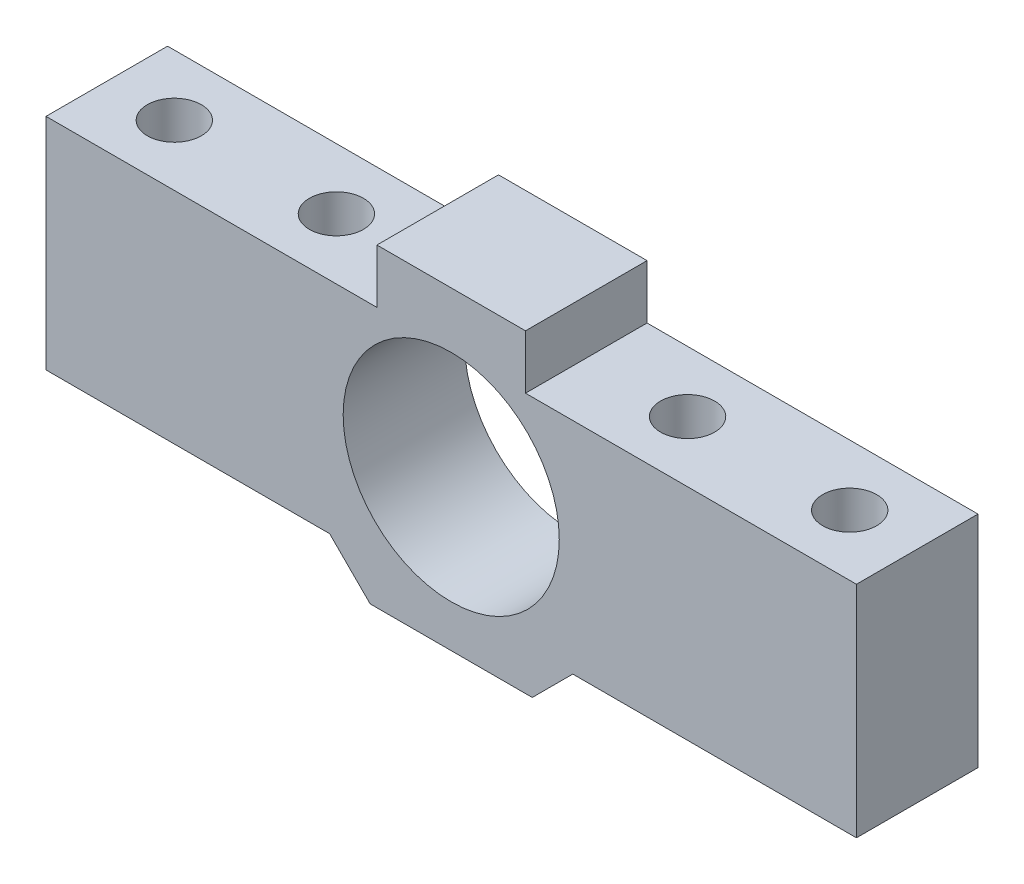
from build123d import *

# Parameters (mm, degrees)
ESQUISSE1_W             = 60
ESQUISSE1_H             = 16.26
ESQUISSE1_R             = 8
BOSS_EXTRU_1_DEPTH      = 9
ESQUISSE2_W             = 11
ESQUISSE2_H             = 4
BOSS_EXTRU_2_DEPTH      = 9
ESQUISSE3_W             = 12
ESQUISSE3_H             = 3
BOSS_EXTRU_3_DEPTH      = 9
CHANFREIN2_SIZE         = 3
ESQUISSE4_R             = 2
ENL_V_MAT_EXTRU_1_DEPTH = 64.964580824


with BuildPart() as part:
    # Esquisse1 → Boss.-Extru.1 (new body)
    with BuildSketch(Plane.XY):
        with Locations((30, 8.13)):
            Rectangle(ESQUISSE1_W, ESQUISSE1_H)
        with Locations((30, 8.13)):
            Circle(ESQUISSE1_R, mode=Mode.SUBTRACT)
    extrude(amount=BOSS_EXTRU_1_DEPTH)

    # Esquisse2 → Boss.-Extru.2 (add)
    with BuildSketch(Plane.XY.offset(9)):
        with Locations((30, 18.26)):
            Rectangle(ESQUISSE2_W, ESQUISSE2_H)
    extrude(amount=-BOSS_EXTRU_2_DEPTH)

    # Esquisse3 → Boss.-Extru.3 (add)
    with BuildSketch(Plane.XY.offset(9)):
        with Locations((30, -1.5)):
            Rectangle(ESQUISSE3_W, ESQUISSE3_H)
    extrude(amount=-BOSS_EXTRU_3_DEPTH)

    # Chanfrein2
    chanfrein2_edges = [part.edges().sort_by_distance(p)[0] for p in [
        (36, 0, 4.5),
        (24, 0, 4.5),
    ]]
    chamfer(chanfrein2_edges, length=CHANFREIN2_SIZE - 0.0001)  # a hair under: the kernel refuses the full size

    # Esquisse4 → Enlèv. mat.-Extru.1 (cut, through all)
    with BuildSketch(Plane.XZ):
        with Locations(Location((17, 4.5, 0), (0, 0, 270))):
            Circle(ESQUISSE4_R)
        with Locations(Location((5, 4.5, 0), (0, 0, 270))):
            Circle(ESQUISSE4_R)
        with Locations(Location((55, 4.5, 0), (0, 0, 270))):
            Circle(ESQUISSE4_R)
        with Locations(Location((43, 4.5, 0), (0, 0, 270))):
            Circle(ESQUISSE4_R)
    extrude(amount=-ENL_V_MAT_EXTRU_1_DEPTH, mode=Mode.SUBTRACT)


solid = part.part
